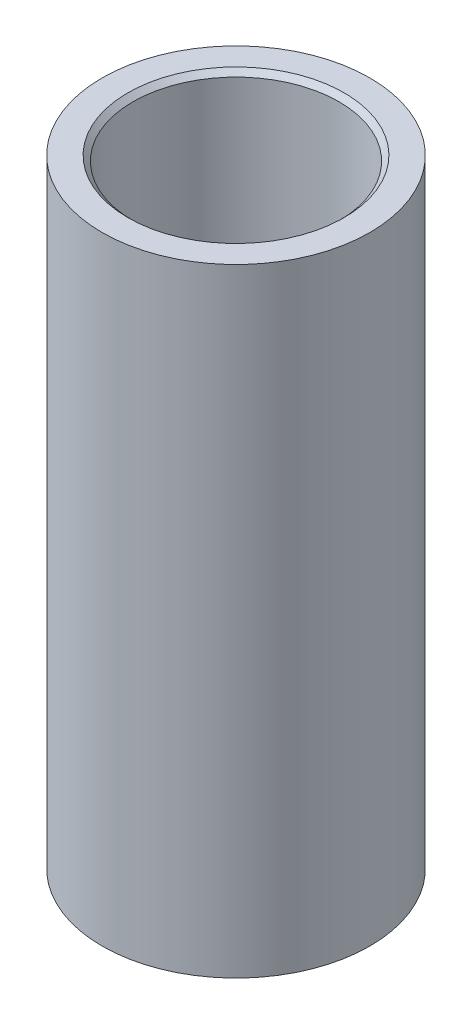
from build123d import *

# Parameters (mm, degrees)
SKETCH1_R           = 13
SKETCH1_R_2         = 10
BOSS_EXTRUDE1_DEPTH = 60
CHAMFER1_SIZE       = 0.5


with BuildPart() as part:
    # Sketch1 → Boss-Extrude1 (new body)
    with BuildSketch(Plane(origin=(0, 0, 0), x_dir=(1, 0, 0), z_dir=(0, 1, 0))):
        Circle(SKETCH1_R)
        Circle(SKETCH1_R_2, mode=Mode.SUBTRACT)
    extrude(amount=BOSS_EXTRUDE1_DEPTH)

    # Chamfer1
    chamfer1_edges = [part.edges().sort_by_distance(p)[0] for p in [
        (-10, 0, 0),
        (-10, 60, 0),
    ]]
    chamfer(chamfer1_edges, length=CHAMFER1_SIZE)


solid = part.part
